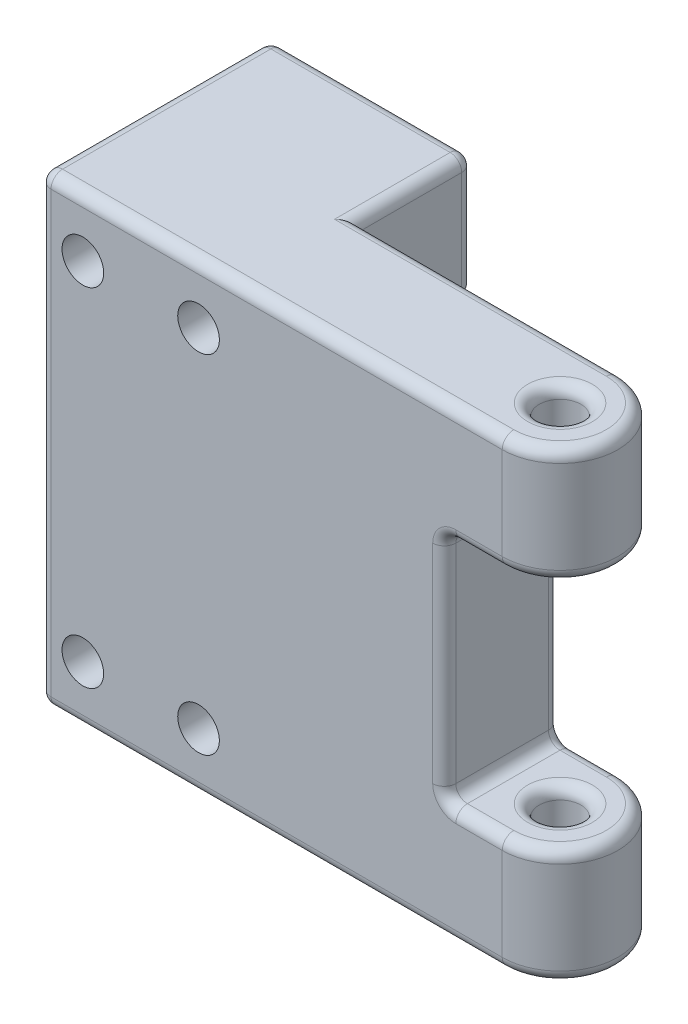
from build123d import *

# Parameters (mm, degrees)
SKETCH1_R               = 2.286
BOSS_EXTRUDE1_DEPTH     = 50.8
CUT_EXTRUDE1_DEPTH      = 66.380335155
CUT_EXTRUDE1_DEPTH_BACK = 66.380335155
SKETCH2_R               = 2.286
SKETCH2_W               = 12.711897402
SKETCH2_H               = 25.4
SKETCH3_W               = 12.7
SKETCH3_H               = 25.4
CUT_EXTRUDE2_DEPTH      = 63.941922635
FILLET1_R               = 1.27


with BuildPart() as part:
    # Sketch1 → Boss-Extrude1 (new body)
    with BuildSketch(Plane(origin=(0, 0, 0), x_dir=(1, 0, 0), z_dir=(0, 1, 0))):
        with BuildLine():
            Line((0, 0), (26.035, 0))
            ThreePointArc((26.035, 0), (32.385, -6.35), (26.035, -12.7))
            Line((26.035, -12.7), (-24.765, -12.7))
            Line((-24.765, -12.7), (-24.765, 12.7))
            Line((-24.765, 12.7), (-2.54, 12.7))
            Line((-2.54, 12.7), (-2.54, 0))
            Line((-2.54, 0), (0, 0))
        make_face()
        with Locations(Location((26.035, -6.35, 0), (0, 0, 270))):
            Circle(SKETCH1_R, mode=Mode.SUBTRACT)
    extrude(amount=BOSS_EXTRUDE1_DEPTH)

    # Sketch2 → Cut-Extrude1 (cut, two sides: drawn at the far end of the back side and taken through both)
    with BuildSketch(Plane.XY.offset(12.7).offset(-CUT_EXTRUDE1_DEPTH_BACK)):
        with Locations((-20.0025, 6.35)):
            Circle(SKETCH2_R)
        with Locations((-7.3025, 6.35)):
            Circle(SKETCH2_R)
        with Locations((-7.3025, 44.45)):
            Circle(SKETCH2_R)
        with Locations((-20.0025, 44.45)):
            Circle(SKETCH2_R)
        with Locations((26.029051299, 25.4)):
            Rectangle(SKETCH2_W, SKETCH2_H)
    extrude(amount=CUT_EXTRUDE1_DEPTH + CUT_EXTRUDE1_DEPTH_BACK, mode=Mode.SUBTRACT)

    # Sketch3 → Cut-Extrude2 (cut, through all)
    with BuildSketch(Plane(origin=(-2.54, 0, 0), x_dir=(0, 0, -1), z_dir=(1, 0, 0))):
        with Locations((6.35, 25.4)):
            Rectangle(SKETCH3_W, SKETCH3_H)
    extrude(amount=-CUT_EXTRUDE2_DEPTH, mode=Mode.SUBTRACT)

    # Fillet1
    # the kernel refuses this fillet: 1.27 mm, written as the material it adds along each edge
    with BuildSketch(Plane(origin=(19.673102598, 12.7, 0), x_dir=(0, 1, 0), z_dir=(0, 0, 1)), Plane(origin=(19.673102598, 38.1, 0), x_dir=(1, 0, 0), z_dir=(0, 0, 1))) as fillet1_piece_1:
        with BuildLine():
            CenterArc((FILLET1_R, -FILLET1_R), FILLET1_R, 90, 90)
            Line((0, -FILLET1_R), (0, 0))
            Line((0, 0), (FILLET1_R, 0))
        make_face()
    extrude(amount=12.7)
    with BuildSketch(Plane(origin=(-2.54, 12.7, 0), x_dir=(0, 0, -1), z_dir=(-1, 0, 0)), Plane(origin=(-2.54, 38.1, 0), x_dir=(0, -1, 0), z_dir=(-1, 0, 0))) as fillet1_piece_2:
        with BuildLine():
            CenterArc((FILLET1_R, -FILLET1_R), FILLET1_R, 90, 90)
            Line((0, -FILLET1_R), (0, 0))
            Line((0, 0), (FILLET1_R, 0))
        make_face()
    extrude(amount=22.225)
    # the kernel refuses this fillet: 1.27 mm, written as the material it takes off along each edge
    with BuildSketch(Plane(origin=(-23.495, 49.53, -11.43), x_dir=(0, 0, -1), z_dir=(-1, 0, 0))) as fillet1_2_piece_1_section:
        Polygon((0, 0), (FILLET1_R, 0), (FILLET1_R, -FILLET1_R), (0, -FILLET1_R), align=None)
    fillet1_2_piece_1 = extrude(amount=FILLET1_R, mode=Mode.PRIVATE)
    fillet1_2_piece_1 = fillet1_2_piece_1 - Plane(origin=(-23.495, 49.53, -11.43), x_dir=(0, -0.7071067811865475, 0.7071067811865475), z_dir=(-1, 0, 0)) * Sphere(FILLET1_R, mode=Mode.PRIVATE)
    add(fillet1_2_piece_1, mode=Mode.SUBTRACT)
    with BuildSketch(Plane(origin=(-3.81, 49.53, -11.43), x_dir=(0, 0, -1), z_dir=(1, 0, 0))) as fillet1_2_piece_2_section:
        Polygon((0, 0), (FILLET1_R, 0), (FILLET1_R, FILLET1_R), (0, FILLET1_R), align=None)
    fillet1_2_piece_2 = extrude(amount=FILLET1_R, mode=Mode.PRIVATE)
    fillet1_2_piece_2 = fillet1_2_piece_2 - Plane(origin=(-3.81, 49.53, -11.43), x_dir=(0, -0.7071067811865475, 0.7071067811865475), z_dir=(1, 0, 0)) * Sphere(FILLET1_R, mode=Mode.PRIVATE)
    add(fillet1_2_piece_2, mode=Mode.SUBTRACT)
    with BuildSketch(Plane(origin=(-23.495, 1.27, 11.43), x_dir=(0, 0, 1), z_dir=(-1, 0, 0))) as fillet1_2_piece_3_section:
        Polygon((0, 0), (FILLET1_R, 0), (FILLET1_R, -FILLET1_R), (0, -FILLET1_R), align=None)
    fillet1_2_piece_3 = extrude(amount=FILLET1_R, mode=Mode.PRIVATE)
    fillet1_2_piece_3 = fillet1_2_piece_3 - Plane(origin=(-23.495, 1.27, 11.43), x_dir=(0, 0.7071067811865475, -0.7071067811865475), z_dir=(-1, 0, 0)) * Sphere(FILLET1_R, mode=Mode.PRIVATE)
    add(fillet1_2_piece_3, mode=Mode.SUBTRACT)
    with BuildSketch(Plane(origin=(-23.495, 49.53, 11.43), x_dir=(0, 0, 1), z_dir=(-1, 0, 0))) as fillet1_2_piece_4_section:
        Polygon((0, 0), (FILLET1_R, 0), (FILLET1_R, FILLET1_R), (0, FILLET1_R), align=None)
    fillet1_2_piece_4 = extrude(amount=FILLET1_R, mode=Mode.PRIVATE)
    fillet1_2_piece_4 = fillet1_2_piece_4 - Plane(origin=(-23.495, 49.53, 11.43), x_dir=(0, -0.7071067811865475, -0.7071067811865475), z_dir=(-1, 0, 0)) * Sphere(FILLET1_R, mode=Mode.PRIVATE)
    add(fillet1_2_piece_4, mode=Mode.SUBTRACT)
    with BuildSketch(Plane(origin=(-23.495, 1.27, -11.43), x_dir=(0, 0, -1), z_dir=(-1, 0, 0))) as fillet1_2_piece_5_section:
        Polygon((0, 0), (FILLET1_R, 0), (FILLET1_R, FILLET1_R), (0, FILLET1_R), align=None)
    fillet1_2_piece_5 = extrude(amount=FILLET1_R, mode=Mode.PRIVATE)
    fillet1_2_piece_5 = fillet1_2_piece_5 - Plane(origin=(-23.495, 1.27, -11.43), x_dir=(0, 0.7071067811865475, 0.7071067811865475), z_dir=(-1, 0, 0)) * Sphere(FILLET1_R, mode=Mode.PRIVATE)
    add(fillet1_2_piece_5, mode=Mode.SUBTRACT)
    with BuildSketch(Plane(origin=(-3.81, 1.27, -11.43), x_dir=(1, 0, 0), z_dir=(0, 0, -1))) as fillet1_2_piece_6_section:
        Polygon((0, 0), (FILLET1_R, 0), (FILLET1_R, FILLET1_R), (0, FILLET1_R), align=None)
    fillet1_2_piece_6 = extrude(amount=FILLET1_R, mode=Mode.PRIVATE)
    fillet1_2_piece_6 = fillet1_2_piece_6 - Plane(origin=(-3.81, 1.27, -11.43), x_dir=(-0.7071067811865475, 0.7071067811865475, 0), z_dir=(0, 0, -1)) * Sphere(FILLET1_R, mode=Mode.PRIVATE)
    add(fillet1_2_piece_6, mode=Mode.SUBTRACT)
    with BuildSketch(Plane(origin=(-23.495, 50.8, -12.7), x_dir=(0, -1, 0), z_dir=(1, 0, 0))) as fillet1_2_piece_7:
        with BuildLine():
            CenterArc((FILLET1_R, -FILLET1_R), FILLET1_R, 90, 90)
            Line((0, -FILLET1_R), (0, 0))
            Line((0, 0), (FILLET1_R, 0))
        make_face()
    extrude(amount=19.685, mode=Mode.SUBTRACT)
    with BuildSketch(Plane(origin=(-24.765, 1.27, 12.7), x_dir=(0, 0, -1), z_dir=(0, 1, 0))) as fillet1_2_piece_8:
        with BuildLine():
            CenterArc((FILLET1_R, -FILLET1_R), FILLET1_R, 90, 90)
            Line((0, -FILLET1_R), (0, 0))
            Line((0, 0), (FILLET1_R, 0))
        make_face()
    extrude(amount=48.26, mode=Mode.SUBTRACT)
    with BuildSketch(Plane(origin=(-24.765, 34.925, -12.7), x_dir=(0, 0, 1), z_dir=(0, 1, 0)), Plane(origin=(-24.765, 1.27, -12.7), x_dir=(0, 0, 1), z_dir=(0, 1, 0)), Plane(origin=(-2.54, 1.27, -12.7), x_dir=(-1, 0, 0), z_dir=(0, 1, 0))) as fillet1_2_piece_9:
        with BuildLine():
            CenterArc((FILLET1_R, FILLET1_R), FILLET1_R, 180, 90)
            Line((0, FILLET1_R), (0, 0))
            Line((0, 0), (FILLET1_R, 0))
        make_face()
    extrude(amount=14.605, mode=Mode.SUBTRACT)
    with BuildSketch(Plane(origin=(-2.54, 34.925, -12.7), x_dir=(0, 0, 1), z_dir=(0, 1, 0))) as fillet1_2_piece_10:
        with BuildLine():
            CenterArc((FILLET1_R, -FILLET1_R), FILLET1_R, 90, 90)
            Line((0, -FILLET1_R), (0, 0))
            Line((0, 0), (FILLET1_R, 0))
        make_face()
    extrude(amount=14.605, mode=Mode.SUBTRACT)
    with BuildSketch(Plane(origin=(-24.765, 50.8, 11.43), x_dir=(0, -1, 0), z_dir=(0, 0, -1))) as fillet1_2_piece_11:
        with BuildLine():
            CenterArc((FILLET1_R, -FILLET1_R), FILLET1_R, 90, 90)
            Line((0, -FILLET1_R), (0, 0))
            Line((0, 0), (FILLET1_R, 0))
        make_face()
    extrude(amount=22.86, mode=Mode.SUBTRACT)
    with BuildSketch(Plane(origin=(26.035, 0, 6.35), x_dir=(0, 0, 1), z_dir=(-1, 0, 0))) as fillet1_2_piece_12:
        with BuildLine():
            CenterArc((2.286 + FILLET1_R, FILLET1_R), FILLET1_R, 180, 90)
            Line((2.286 + FILLET1_R, 0), (2.286, 0))
            Line((2.286, 0), (2.286, FILLET1_R))
        make_face()
    revolve(axis=Axis((26.035, 0, 6.35), (0, 1, 0)), mode=Mode.SUBTRACT)
    with BuildSketch(Plane(origin=(26.035, 50.8, 6.35), x_dir=(0, 0, 1), z_dir=(-1, 0, 0))) as fillet1_2_piece_13:
        with BuildLine():
            CenterArc((2.286 + FILLET1_R, -FILLET1_R), FILLET1_R, 90, 90)
            Line((2.286 + FILLET1_R, 0), (2.286, 0))
            Line((2.286, 0), (2.286, -FILLET1_R))
        make_face()
    revolve(axis=Axis((26.035, 50.8, 6.35), (0, 1, 0)), mode=Mode.SUBTRACT)
    with BuildSketch(Plane(origin=(26.035, 50.8, 12.7), x_dir=(0, 0, -1), z_dir=(-1, 0, 0)), Plane(origin=(26.035, 0, 12.7), x_dir=(0, 1, 0), z_dir=(-1, 0, 0))) as fillet1_2_piece_14:
        with BuildLine():
            CenterArc((FILLET1_R, FILLET1_R), FILLET1_R, 180, 90)
            Line((0, FILLET1_R), (0, 0))
            Line((0, 0), (FILLET1_R, 0))
        make_face()
    extrude(amount=49.53, mode=Mode.SUBTRACT)
    with BuildSketch(Plane(origin=(26.035, 50.8, 6.35), x_dir=(0, 0, -1), z_dir=(-1, 0, 0))) as fillet1_2_piece_15:
        with BuildLine():
            CenterArc((6.35 - FILLET1_R, FILLET1_R), FILLET1_R, 270, 90)
            Line((6.35 - FILLET1_R, 0), (6.35, 0))
            Line((6.35, 0), (6.35, FILLET1_R))
        make_face()
    revolve(axis=Axis((26.035, 50.8, 6.35), (0, -1, 0)), revolution_arc=180, mode=Mode.SUBTRACT)
    with BuildSketch(Plane(origin=(-20.0025, 44.45, -12.7), x_dir=(1, 0, 0), z_dir=(0, -1, 0))) as fillet1_2_piece_16:
        with BuildLine():
            CenterArc((2.286 + FILLET1_R, FILLET1_R), FILLET1_R, 180, 90)
            Line((2.286, FILLET1_R), (2.286, 0))
            Line((2.286, 0), (2.286 + FILLET1_R, 0))
        make_face()
    revolve(axis=Axis((-20.0025, 44.45, -12.7), (0, 0, 1)), mode=Mode.SUBTRACT)
    with BuildSketch(Plane(origin=(-7.3025, 44.45, -12.7), x_dir=(1, 0, 0), z_dir=(0, -1, 0))) as fillet1_2_piece_17:
        with BuildLine():
            CenterArc((2.286 + FILLET1_R, FILLET1_R), FILLET1_R, 180, 90)
            Line((2.286, FILLET1_R), (2.286, 0))
            Line((2.286, 0), (2.286 + FILLET1_R, 0))
        make_face()
    revolve(axis=Axis((-7.3025, 44.45, -12.7), (0, 0, 1)), mode=Mode.SUBTRACT)
    with BuildSketch(Plane(origin=(-7.3025, 6.35, -12.7), x_dir=(1, 0, 0), z_dir=(0, -1, 0))) as fillet1_2_piece_18:
        with BuildLine():
            CenterArc((2.286 + FILLET1_R, FILLET1_R), FILLET1_R, 180, 90)
            Line((2.286, FILLET1_R), (2.286, 0))
            Line((2.286, 0), (2.286 + FILLET1_R, 0))
        make_face()
    revolve(axis=Axis((-7.3025, 6.35, -12.7), (0, 0, 1)), mode=Mode.SUBTRACT)
    with BuildSketch(Plane(origin=(26.035, 12.7, 6.35), x_dir=(0, 0, 1), z_dir=(1, 0, 0))) as fillet1_2_piece_19:
        with BuildLine():
            CenterArc((2.286 + FILLET1_R, FILLET1_R), FILLET1_R, 180, 90)
            Line((2.286, FILLET1_R), (2.286, 0))
            Line((2.286, 0), (2.286 + FILLET1_R, 0))
        make_face()
    revolve(axis=Axis((26.035, 12.7, 6.35), (0, -1, 0)), mode=Mode.SUBTRACT)
    with BuildSketch(Plane(origin=(26.035, 38.1, 6.35), x_dir=(0, 0, 1), z_dir=(1, 0, 0))) as fillet1_2_piece_20:
        with BuildLine():
            CenterArc((2.286 + FILLET1_R, -FILLET1_R), FILLET1_R, 90, 90)
            Line((2.286, -FILLET1_R), (2.286, 0))
            Line((2.286, 0), (2.286 + FILLET1_R, 0))
        make_face()
    revolve(axis=Axis((26.035, 38.1, 6.35), (0, -1, 0)), mode=Mode.SUBTRACT)
    with BuildSketch(Plane(origin=(-2.54, 50.8, 0), x_dir=(0, -1, 0), z_dir=(1, 0, 0)), Plane(origin=(26.035, 0, 0), x_dir=(0, 1, 0), z_dir=(-1, 0, 0))) as fillet1_2_piece_21:
        with BuildLine():
            CenterArc((FILLET1_R, -FILLET1_R), FILLET1_R, 90, 90)
            Line((0, -FILLET1_R), (0, 0))
            Line((0, 0), (FILLET1_R, 0))
        make_face()
    extrude(amount=28.575, mode=Mode.SUBTRACT)
    with BuildSketch(Plane(origin=(-20.0025, 6.35, -12.7), x_dir=(1, 0, 0), z_dir=(0, -1, 0))) as fillet1_2_piece_22:
        with BuildLine():
            CenterArc((2.286 + FILLET1_R, FILLET1_R), FILLET1_R, 180, 90)
            Line((2.286, FILLET1_R), (2.286, 0))
            Line((2.286, 0), (2.286 + FILLET1_R, 0))
        make_face()
    revolve(axis=Axis((-20.0025, 6.35, -12.7), (0, 0, 1)), mode=Mode.SUBTRACT)
    with BuildSketch(Plane(origin=(0.635, 38.1, -12.7), x_dir=(0, 0, 1), z_dir=(-1, 0, 0)), Plane(origin=(0.635, 12.7, -12.7), x_dir=(0, -1, 0), z_dir=(-1, 0, 0))) as fillet1_2_piece_23:
        with BuildLine():
            CenterArc((FILLET1_R, FILLET1_R), FILLET1_R, 180, 90)
            Line((0, FILLET1_R), (0, 0))
            Line((0, 0), (FILLET1_R, 0))
        make_face()
    extrude(amount=28.575, mode=Mode.SUBTRACT)
    with BuildSketch(Plane(origin=(26.035, 0, 6.35), x_dir=(0, 0, -1), z_dir=(-1, 0, 0))) as fillet1_2_piece_24:
        with BuildLine():
            CenterArc((6.35 - FILLET1_R, -FILLET1_R), FILLET1_R, 0, 90)
            Line((6.35 - FILLET1_R, 0), (6.35, 0))
            Line((6.35, 0), (6.35, -FILLET1_R))
        make_face()
    revolve(axis=Axis((26.035, 0, 6.35), (0, -1, 0)), revolution_arc=180, mode=Mode.SUBTRACT)
    with BuildSketch(Plane(origin=(-24.765, 0, 11.43), x_dir=(0, 1, 0), z_dir=(0, 0, -1))) as fillet1_2_piece_25:
        with BuildLine():
            CenterArc((FILLET1_R, FILLET1_R), FILLET1_R, 180, 90)
            Line((0, FILLET1_R), (0, 0))
            Line((0, 0), (FILLET1_R, 0))
        make_face()
    extrude(amount=22.86, mode=Mode.SUBTRACT)
    with BuildSketch(Plane(origin=(-2.54, 50.8, -11.43), x_dir=(0, -1, 0), z_dir=(0, 0, 1))) as fillet1_2_piece_26:
        with BuildLine():
            CenterArc((FILLET1_R, -FILLET1_R), FILLET1_R, 90, 90)
            Line((0, -FILLET1_R), (0, 0))
            Line((0, 0), (FILLET1_R, 0))
        make_face()
    extrude(amount=11.43, mode=Mode.SUBTRACT)
    with BuildSketch(Plane(origin=(-23.495, 0, -12.7), x_dir=(0, 1, 0), z_dir=(1, 0, 0))) as fillet1_2_piece_27:
        with BuildLine():
            CenterArc((FILLET1_R, FILLET1_R), FILLET1_R, 180, 90)
            Line((0, FILLET1_R), (0, 0))
            Line((0, 0), (FILLET1_R, 0))
        make_face()
    extrude(amount=19.685, mode=Mode.SUBTRACT)
    with BuildSketch(Plane(origin=(-2.54, 0, -11.43), x_dir=(0, 1, 0), z_dir=(0, 0, 1))) as fillet1_2_piece_28:
        with BuildLine():
            CenterArc((FILLET1_R, FILLET1_R), FILLET1_R, 180, 90)
            Line((0, FILLET1_R), (0, 0))
            Line((0, 0), (FILLET1_R, 0))
        make_face()
    extrude(amount=11.43, mode=Mode.SUBTRACT)
    with BuildSketch(Plane(origin=(-5.715, 50.8, 0), x_dir=(0, -1, 0), z_dir=(1, 0, 0))) as fillet1_2_piece_29a_section:
        with BuildLine():
            CenterArc((FILLET1_R, -FILLET1_R), FILLET1_R, 90, 90)
            Line((0, -FILLET1_R), (0, 0))
            Line((0, 0), (FILLET1_R, 0))
        make_face()
    fillet1_2_piece_29a = extrude(amount=31.75, mode=Mode.PRIVATE)
    fillet1_2_piece_29a = split(fillet1_2_piece_29a, bisect_by=Plane(origin=(-2.54, 50.512478205, 0.287521795), z_dir=(-1, 0, 0)), keep=Keep.TOP, mode=Mode.PRIVATE)
    with BuildSketch(Plane(origin=(-2.54, 50.8, -11.43), x_dir=(0, -1, 0), z_dir=(0, 0, 1))) as fillet1_2_piece_29b_section:
        with BuildLine():
            CenterArc((FILLET1_R, -FILLET1_R), FILLET1_R, 90, 90)
            Line((0, -FILLET1_R), (0, 0))
            Line((0, 0), (FILLET1_R, 0))
        make_face()
    fillet1_2_piece_29b = extrude(amount=14.605, mode=Mode.PRIVATE)
    fillet1_2_piece_29b = split(fillet1_2_piece_29b, bisect_by=Plane(origin=(-2.827521795, 50.512478205, 0), z_dir=(0, 0, 1)), keep=Keep.TOP, mode=Mode.PRIVATE)
    fillet1_2_piece_29 = fillet1_2_piece_29a & fillet1_2_piece_29b
    add(fillet1_2_piece_29, mode=Mode.SUBTRACT)
    with BuildSketch(Plane(origin=(-2.54, 0, -11.43), x_dir=(0, 1, 0), z_dir=(0, 0, 1))) as fillet1_2_piece_30a_section:
        with BuildLine():
            CenterArc((FILLET1_R, FILLET1_R), FILLET1_R, 180, 90)
            Line((0, FILLET1_R), (0, 0))
            Line((0, 0), (FILLET1_R, 0))
        make_face()
    fillet1_2_piece_30a = extrude(amount=14.605, mode=Mode.PRIVATE)
    fillet1_2_piece_30a = split(fillet1_2_piece_30a, bisect_by=Plane(origin=(-2.827521795, 0.287521795, 0), z_dir=(0, 0, 1)), keep=Keep.TOP, mode=Mode.PRIVATE)
    with BuildSketch(Plane(origin=(26.035, 0, 0), x_dir=(0, 1, 0), z_dir=(-1, 0, 0))) as fillet1_2_piece_30b_section:
        with BuildLine():
            CenterArc((FILLET1_R, -FILLET1_R), FILLET1_R, 90, 90)
            Line((0, -FILLET1_R), (0, 0))
            Line((0, 0), (FILLET1_R, 0))
        make_face()
    fillet1_2_piece_30b = extrude(amount=31.75, mode=Mode.PRIVATE)
    fillet1_2_piece_30b = split(fillet1_2_piece_30b, bisect_by=Plane(origin=(-2.54, 0.287521795, 0.287521795), z_dir=(-1, 0, 0)), keep=Keep.TOP, mode=Mode.PRIVATE)
    fillet1_2_piece_30 = fillet1_2_piece_30a & fillet1_2_piece_30b
    add(fillet1_2_piece_30, mode=Mode.SUBTRACT)
    # the kernel refuses this fillet: 1.27 mm, written as the material it takes off along each edge
    with BuildSketch(Plane(origin=(19.673102598, 36.83, 0), x_dir=(0, 0, 1), z_dir=(0, -1, 0)), Plane(origin=(19.673102598, 13.97, 12.7), x_dir=(0, 0, -1), z_dir=(0, 1, 0))) as fillet1_3_piece_1:
        with BuildLine():
            CenterArc((FILLET1_R, FILLET1_R), FILLET1_R, 180, 90)
            Line((0, FILLET1_R), (0, 0))
            Line((0, 0), (FILLET1_R, 0))
        make_face()
    extrude(amount=22.86, mode=Mode.SUBTRACT)
    with BuildSketch(Plane(origin=(26.035, 12.7, 6.35), x_dir=(0, 0, 1), z_dir=(-1, 0, 0))) as fillet1_3_piece_2:
        with BuildLine():
            CenterArc((6.35 - FILLET1_R, -FILLET1_R), FILLET1_R, 360, 90)
            Line((6.35, -FILLET1_R), (6.35, 0))
            Line((6.35, 0), (6.35 - FILLET1_R, 0))
        make_face()
    revolve(axis=Axis((26.035, 12.7, 6.35), (0, 1, 0)), revolution_arc=180, mode=Mode.SUBTRACT)
    with BuildSketch(Plane(origin=(26.035, 12.7, 12.7), x_dir=(0, 0, -1), z_dir=(-1, 0, 0)), Plane(origin=(20.943102598, 12.7, 0), x_dir=(0, 0, 1), z_dir=(1, 0, 0)), Plane(origin=(20.943102598, 38.1, 12.7), x_dir=(0, 0, -1), z_dir=(1, 0, 0)), Plane(origin=(26.035, 38.1, 0), x_dir=(0, 0, 1), z_dir=(-1, 0, 0))) as fillet1_3_piece_3:
        with BuildLine():
            CenterArc((FILLET1_R, FILLET1_R), FILLET1_R, 180, 90)
            Line((0, FILLET1_R), (0, 0))
            Line((0, 0), (FILLET1_R, 0))
        make_face()
    extrude(amount=5.091897402, mode=Mode.SUBTRACT)
    with BuildSketch(Plane(origin=(26.035, 38.1, 6.35), x_dir=(0, 0, 1), z_dir=(-1, 0, 0))) as fillet1_3_piece_4:
        with BuildLine():
            CenterArc((6.35 - FILLET1_R, FILLET1_R), FILLET1_R, 270, 90)
            Line((6.35 - FILLET1_R, 0), (6.35, 0))
            Line((6.35, 0), (6.35, FILLET1_R))
        make_face()
    revolve(axis=Axis((26.035, 38.1, 6.35), (0, 1, 0)), revolution_arc=180, mode=Mode.SUBTRACT)
    with BuildSketch(Plane(origin=(20.943102598, 36.83, 0), x_dir=(0, 1, 0), z_dir=(1, 0, 0))) as fillet1_3_piece_5:
        with BuildLine():
            CenterArc((1.27 + FILLET1_R, FILLET1_R), FILLET1_R, 180, 90)
            Line((1.27 + FILLET1_R, 0), (1.27, 0))
            Line((1.27, 0), (1.27, FILLET1_R))
        make_face()
    revolve(axis=Axis((20.943102598, 36.83, 0), (0, 0, 1)), revolution_arc=90, mode=Mode.SUBTRACT)
    with BuildSketch(Plane(origin=(20.943102598, 36.83, 12.7), x_dir=(0, 1, 0), z_dir=(1, 0, 0))) as fillet1_3_piece_6:
        with BuildLine():
            CenterArc((1.27 + FILLET1_R, -FILLET1_R), FILLET1_R, 90, 90)
            Line((1.27 + FILLET1_R, 0), (1.27, 0))
            Line((1.27, 0), (1.27, -FILLET1_R))
        make_face()
    revolve(axis=Axis((20.943102598, 36.83, 12.7), (0, 0, 1)), revolution_arc=90, mode=Mode.SUBTRACT)
    with BuildSketch(Plane(origin=(20.943102598, 13.97, 0), x_dir=(-1, 0, 0), z_dir=(0, 1, 0))) as fillet1_3_piece_7:
        with BuildLine():
            CenterArc((1.27 + FILLET1_R, FILLET1_R), FILLET1_R, 180, 90)
            Line((1.27 + FILLET1_R, 0), (1.27, 0))
            Line((1.27, 0), (1.27, FILLET1_R))
        make_face()
    revolve(axis=Axis((20.943102598, 13.97, 0), (0, 0, 1)), revolution_arc=90, mode=Mode.SUBTRACT)
    with BuildSketch(Plane(origin=(20.943102598, 13.97, 12.7), x_dir=(-1, 0, 0), z_dir=(0, 1, 0))) as fillet1_3_piece_8:
        with BuildLine():
            CenterArc((1.27 + FILLET1_R, -FILLET1_R), FILLET1_R, 90, 90)
            Line((1.27 + FILLET1_R, 0), (1.27, 0))
            Line((1.27, 0), (1.27, -FILLET1_R))
        make_face()
    revolve(axis=Axis((20.943102598, 13.97, 12.7), (0, 0, 1)), revolution_arc=90, mode=Mode.SUBTRACT)


solid = part.part
